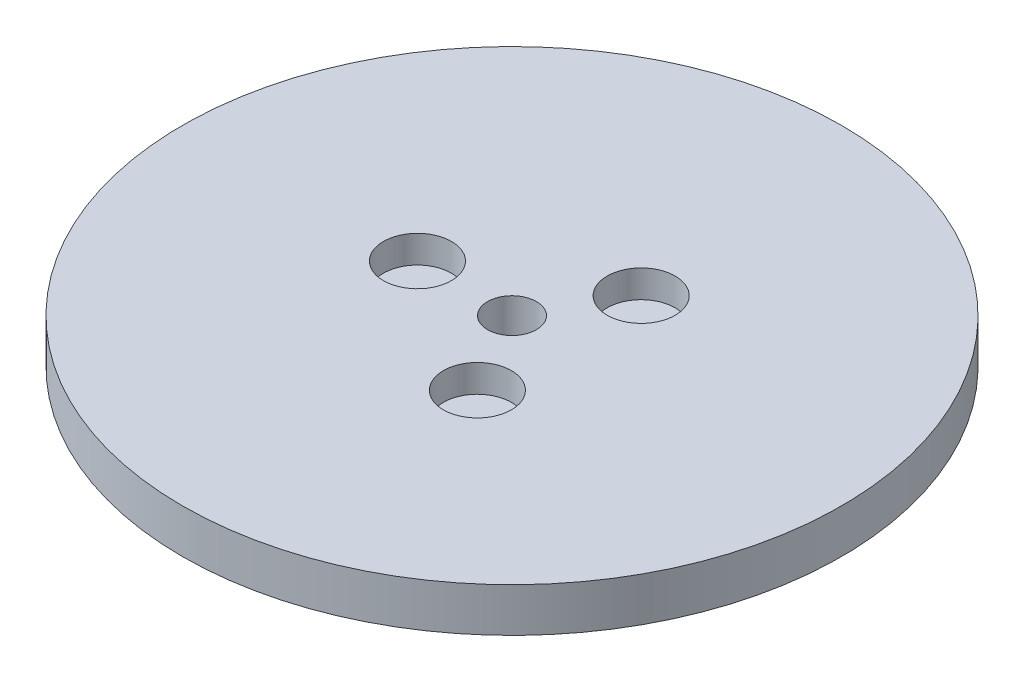
from build123d import *

# Parameters (mm, degrees)
SKETCH1_R           = 67.5
BOSS_EXTRUDE1_DEPTH = 9
SKETCH2_R           = 5
CUT_EXTRUDE1_DEPTH  = 96.882740887
SKETCH3_R           = 6.963071563
CUT_EXTRUDE2_DEPTH  = 5.635776031
CIRPATTERN1_COUNT   = 3


with BuildPart() as part:
    # Sketch1 → Boss-Extrude1 (new body)
    with BuildSketch(Plane(origin=(0, 0, 0), x_dir=(1, 0, 0), z_dir=(0, 1, 0))):
        Circle(SKETCH1_R)
    extrude(amount=BOSS_EXTRUDE1_DEPTH)

    # Sketch2 → Cut-Extrude1 (cut, through all)
    with BuildSketch(Plane(origin=(0, 0, 0), x_dir=(1, 0, 0), z_dir=(0, 1, 0))):
        Circle(SKETCH2_R)
    extrude(amount=CUT_EXTRUDE1_DEPTH, mode=Mode.SUBTRACT)

    # Sketch3 → Cut-Extrude2 (cut)
    with BuildSketch(Plane(origin=(0, 9, 0), x_dir=(1, 0, 0), z_dir=(0, 1, 0))):
        with Locations((-19.369136598, 0)):
            Circle(SKETCH3_R)
    cut_extrude2 = extrude(amount=-CUT_EXTRUDE2_DEPTH, mode=Mode.SUBTRACT)

    # CirPattern1: Cut-Extrude2 ×3 about axis
    cirpattern1_axis = Axis((0, 0, 0), (0, 1, 0))
    for i in range(1, CIRPATTERN1_COUNT):
        add(cut_extrude2.rotate(cirpattern1_axis, i * 360 / CIRPATTERN1_COUNT), mode=Mode.SUBTRACT)


solid = part.part
